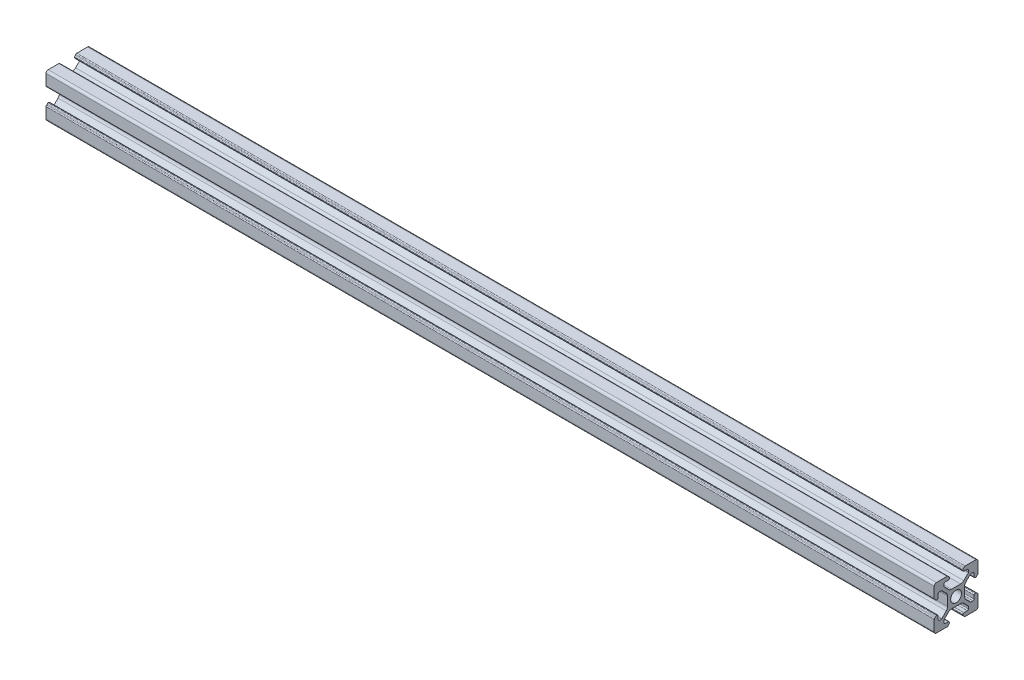
from build123d import *

# Parameters (mm, degrees)
SKETCH1_W                = 20
SKETCH1_H                = 20
BOSS_EXTRUDE1_DEPTH      = 406
FILLET1_R                = 1
CUT_EXTRUDE1_DEPTH       = 407.246230752
F_5_0_5_DIAMETER_HOLE1_D = 5
FILLET2_R                = 2
FILLET3_R                = 0.5
FILLET4_R                = 0.5
FILLET5_R                = 0.5


with BuildPart() as part:
    # Sketch1 → Boss-Extrude1 (new body)
    with BuildSketch(Plane(origin=(0, 0, 0), x_dir=(0, 0, -1), z_dir=(1, 0, 0))):
        Rectangle(SKETCH1_W, SKETCH1_H)
    extrude(amount=BOSS_EXTRUDE1_DEPTH)

    # Fillet1
    fillet1_edges = [part.edges().sort_by_distance(p)[0] for p in [
        (203, 10, 10),
        (203, 10, -10),
        (203, -10, -10),
        (203, -10, 10),
    ]]
    fillet(fillet1_edges, radius=FILLET1_R)

    # Sketch3 → Cut-Extrude1 (cut, through all)
    with BuildSketch(Plane.ZY):
        Polygon((-3.6, 10), (3.6, 10), (3.6, 9.5), (3.1, 9.5), (3.1, 8.2), (5.63, 8.2), (5.63, 6.619949494), (2.910050506, 3.9), (-2.910050506, 3.9), (-5.63, 6.619949494), (-5.63, 8.2), (-3.1, 8.2), (-3.1, 9.5), (-3.6, 9.5), align=None)
        Polygon((10, 3.6), (10, -3.6), (9.5, -3.6), (9.5, -3.1), (8.2, -3.1), (8.2, -5.63), (6.619949494, -5.63), (3.9, -2.910050506), (3.9, 2.910050506), (6.619949494, 5.63), (8.2, 5.63), (8.2, 3.1), (9.5, 3.1), (9.5, 3.6), align=None)
        Polygon((3.6, -10), (-3.6, -10), (-3.6, -9.5), (-3.1, -9.5), (-3.1, -8.2), (-5.63, -8.2), (-5.63, -6.619949494), (-2.910050506, -3.9), (2.910050506, -3.9), (5.63, -6.619949494), (5.63, -8.2), (3.1, -8.2), (3.1, -9.5), (3.6, -9.5), align=None)
        Polygon((-10, -3.6), (-10, 3.6), (-9.5, 3.6), (-9.5, 3.1), (-8.2, 3.1), (-8.2, 5.63), (-6.619949494, 5.63), (-3.9, 2.910050506), (-3.9, -2.910050506), (-6.619949494, -5.63), (-8.2, -5.63), (-8.2, -3.1), (-9.5, -3.1), (-9.5, -3.6), align=None)
    extrude(amount=-CUT_EXTRUDE1_DEPTH, mode=Mode.SUBTRACT)

    # Ø5.0 (5) Diameter Hole1 (through all)
    with Locations(Plane.ZY):
        with Locations((0, 0)):
            Hole(F_5_0_5_DIAMETER_HOLE1_D / 2)

    # Fillet2
    fillet2_edges = [part.edges().sort_by_distance(p)[0] for p in [
        (203, -3.9, -2.910050506),
        (203, -3.9, 2.910050506),
        (203, 2.910050506, -3.9),
        (203, -2.910050506, -3.9),
        (203, -2.910050506, 3.9),
        (203, 2.910050506, 3.9),
        (203, 3.9, 2.910050506),
        (203, 3.9, -2.910050506),
    ]]
    fillet(fillet2_edges, radius=FILLET2_R)

    # Fillet3
    fillet3_edges = [part.edges().sort_by_distance(p)[0] for p in [
        (203, 3.6, -10),
        (203, 3.1, -9.5),
        (203, 3.1, -8.2),
        (203, 5.63, -8.2),
        (203, 5.63, -6.619949494),
        (203, 3.6, 10),
        (203, 3.1, 9.5),
        (203, 3.1, 8.2),
        (203, 5.63, 8.2),
        (203, 5.63, 6.619949494),
        (203, 6.619949494, 5.63),
        (203, 8.2, 5.63),
        (203, 8.2, 3.1),
        (203, 9.5, 3.1),
        (203, 10, 3.6),
        (203, 9.5, -3.1),
        (203, 10, -3.6),
        (203, 8.2, -3.1),
        (203, 8.2, -5.63),
        (203, 6.619949494, -5.63),
    ]]
    fillet(fillet3_edges, radius=FILLET3_R - 0.0001)  # a hair under: the kernel refuses the full size

    # Fillet4
    fillet4_edges = [part.edges().sort_by_distance(p)[0] for p in [
        (203, -3.6, 10),
        (203, -3.1, 9.5),
        (203, -3.1, 8.2),
        (203, -5.63, 8.2),
        (203, -5.63, 6.619949494),
        (203, -6.619949494, 5.63),
        (203, -8.2, 5.63),
        (203, -8.2, 3.1),
        (203, -10, 3.6),
        (203, -9.5, 3.1),
        (203, -10, -3.6),
        (203, -9.5, -3.1),
        (203, -8.2, -3.1),
        (203, -8.2, -5.63),
        (203, -6.619949494, -5.63),
        (203, -5.63, -6.619949494),
        (203, -5.63, -8.2),
        (203, -3.1, -8.2),
        (203, -3.1, -9.5),
        (203, -3.6, -10),
    ]]
    fillet(fillet4_edges, radius=FILLET4_R - 0.0001)  # a hair under: the kernel refuses the full size

    # Fillet5
    fillet5_edges = [part.edges().sort_by_distance(p)[0] for p in [
        (203, 3.6, 9.5),
        (203, 9.5, 3.6),
        (203, 9.5, -3.6),
        (203, 3.6, -9.5),
        (203, -3.6, 9.5),
        (203, -9.5, 3.6),
        (203, -9.5, -3.6),
        (203, -3.6, -9.5),
    ]]
    fillet(fillet5_edges, radius=FILLET5_R)


solid = part.part
